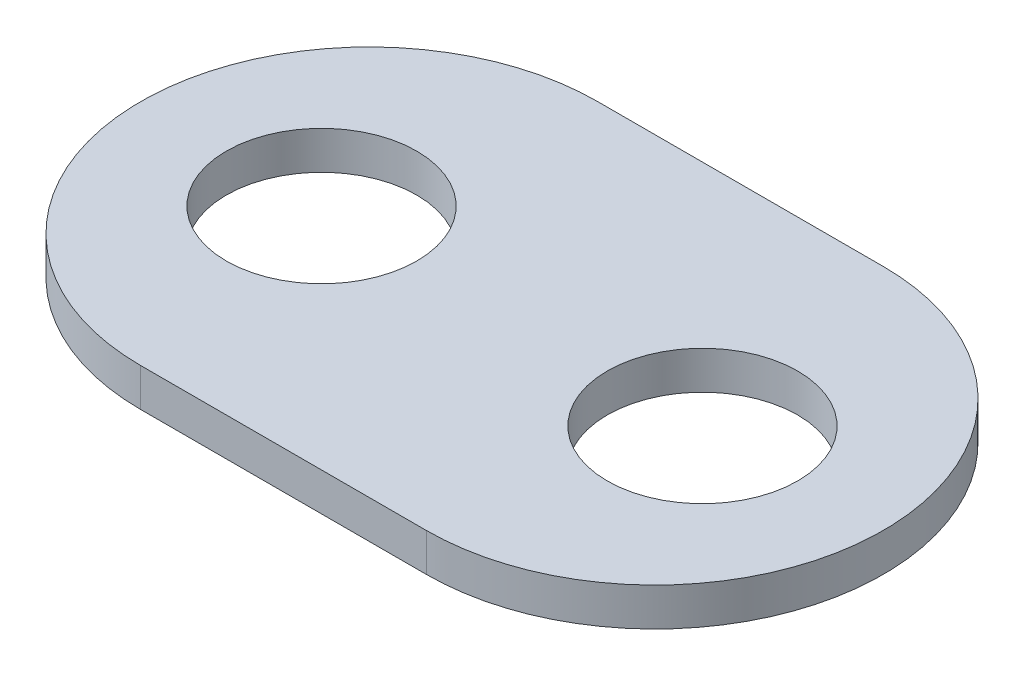
from build123d import *

# Parameters (mm, degrees)
SKETCH1_R           = 5
BOSS_EXTRUDE1_DEPTH = 2


with BuildPart() as part:
    # Sketch1 → Boss-Extrude1 (new body)
    with BuildSketch(Plane(origin=(0, 0, 0), x_dir=(1, 0, 0), z_dir=(0, 1, 0))):
        with BuildLine():
            ThreePointArc((-7.5, 12), (-19.5, 0), (-7.5, -12))
            Line((-7.5, -12), (7.5, -12))
            ThreePointArc((7.5, -12), (19.5, 0), (7.5, 12))
            Line((7.5, 12), (-7.5, 12))
        make_face()
        with Locations((-10, 0)):
            Circle(SKETCH1_R, mode=Mode.SUBTRACT)
        with Locations((10, 0)):
            Circle(SKETCH1_R, mode=Mode.SUBTRACT)
    extrude(amount=BOSS_EXTRUDE1_DEPTH)


solid = part.part
